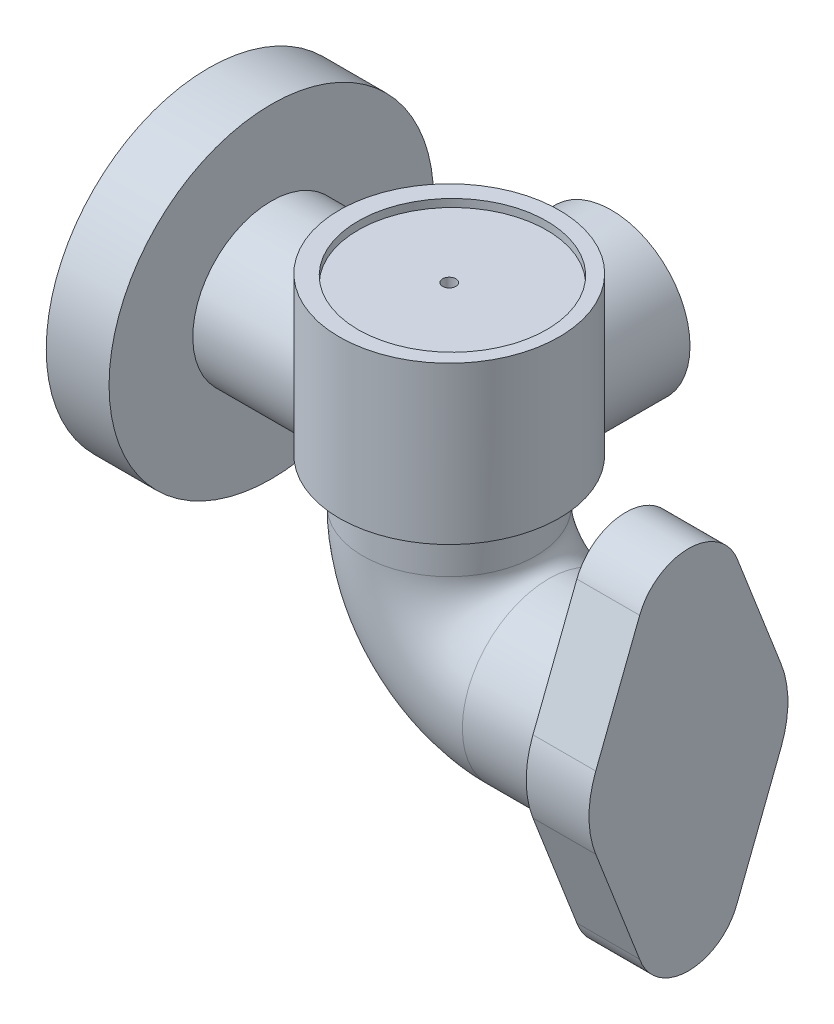
from build123d import *

# Parameters (mm, degrees)
SKETCH4_W           = 420
SKETCH4_H           = 600
SKETCH5_R           = 330
BOSS_EXTRUDE1_DEPTH = 240
SKETCH12_W          = 620
SKETCH12_H          = 300
SKETCH13_R          = 360
CUT_EXTRUDE1_DEPTH  = 30


with BuildPart() as part:
    # Sketch2 → Revolve1 (revolve)
    with BuildSketch(Plane.XY):
        Polygon((0, 0), (0, 620), (240, 620), (240, 300), (920, 300), (920, 0), align=None)
    revolve(axis=Axis((920, 0, 0), (-1, 0, 0)))

    # Sketch4 → Revolve2 (revolve)
    with BuildSketch(Plane(origin=(920, 0, 0), x_dir=(0, 0, -1), z_dir=(1, 0, 0))):
        with Locations((210, 100)):
            Rectangle(SKETCH4_W, SKETCH4_H)
    revolve(axis=Axis((920, 400, 0), (0, -1, 0)))

    # Sweep1: sweep along a path in Sketch6
    with BuildLine(Plane.XY) as sweep1_path:
        Line((920, -200), (920, -370))
        ThreePointArc((920, -370), (1031.299423149, -638.700576851), (1300, -750))
        Line((1300, -750), (1593.957319136, -750))
    # Sketch5 → Sweep1 (sweep)
    with BuildSketch(Plane.XZ.offset(200)):
        with Locations((920, 0)):
            Circle(SKETCH5_R)
    sweep(path=sweep1_path.line)

    # Sketch12 → Revolve3 (revolve)
    with BuildSketch(Plane(origin=(920, 0, 0), x_dir=(0, 0, -1), z_dir=(1, 0, 0))):
        with Locations((310, 150)):
            Rectangle(SKETCH12_W, SKETCH12_H)
    revolve(axis=Axis((920, 0, 0), (0, 0, -1)))

    # Sketch13 → Cut-Extrude1 (cut)
    with BuildSketch(Plane(origin=(0, 400, 0), x_dir=(1, 0, 0), z_dir=(0, 1, 0))):
        with Locations((932.085409767, 0)):
            Circle(SKETCH13_R)
    extrude(amount=-CUT_EXTRUDE1_DEPTH, mode=Mode.SUBTRACT)

    # Sketch15 → M56 Tapped Hole1 (revolve, cut)
    with BuildSketch(Plane(origin=(920, 370, 0), x_dir=(0, 0, 1), z_dir=(1, 0, 0))):
        Polygon((0, 0), (0, 235.17173063), (25.25, 220), (25.25, 0), align=None)
    revolve(axis=Axis((920, 376.35, 0), (0, -1, 0)), mode=Mode.SUBTRACT)


with BuildPart() as body_2:
    # Sketch8 → Boss-Extrude1 (new body)
    with BuildSketch(Plane(origin=(1593.957319136, 0, 0), x_dir=(0, 0, -1), z_dir=(1, 0, 0))):
        with BuildLine():
            Line((-186.408328821, -180.774096366), (-354.17582476, -612.306553695))
            ThreePointArc((-354.17582476, -612.306553695), (-380, -750), (-354.17582476, -887.693446305))
            Line((-354.17582476, -887.693446305), (-186.408328821, -1319.225903634))
            ThreePointArc((-186.408328821, -1319.225903634), (0, -1450.985659636), (186.408328821, -1319.225903634))
            Line((186.408328821, -1319.225903634), (354.17582476, -887.693446305))
            ThreePointArc((354.17582476, -887.693446305), (380, -750), (354.17582476, -612.306553695))
            Line((354.17582476, -612.306553695), (186.408328821, -180.774096366))
            ThreePointArc((186.408328821, -180.774096366), (0, -53.244331264), (-186.408328821, -180.774096366))
        make_face()
    extrude(amount=BOSS_EXTRUDE1_DEPTH)


solid = Compound([part.part, body_2.part])
